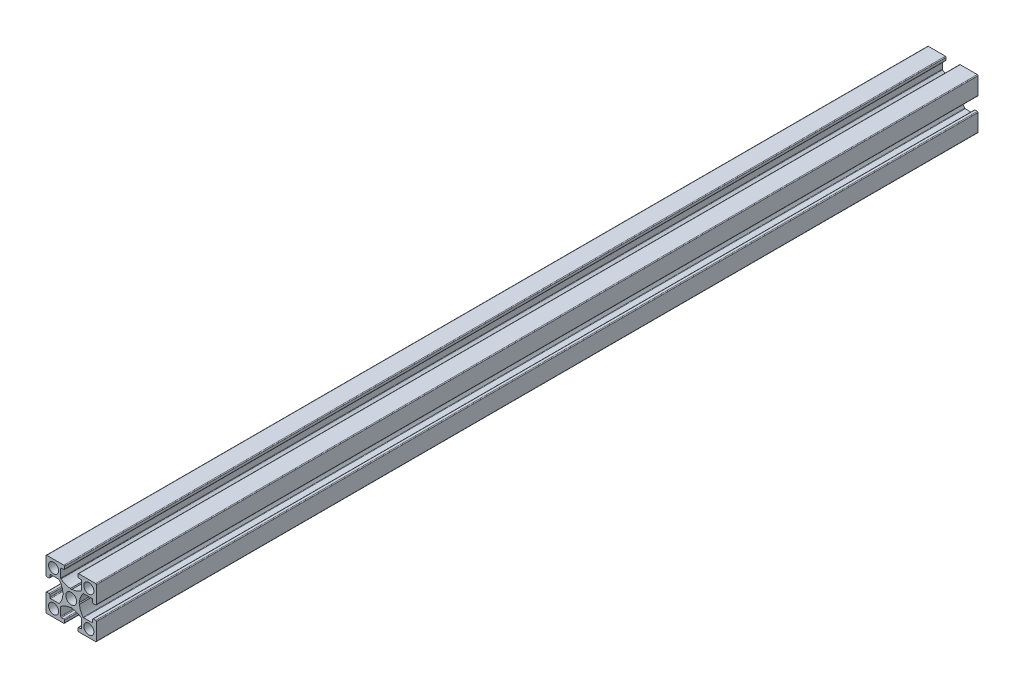
from build123d import *

# Parameters (mm, degrees)
MODEL_R                 = 2.15
MODEL_R_2               = 2
EXTRUDE_1_DEPTH         = 350
CUT_EXTRUDE_START       = -18.707817398
CUT_EXTRUDE_1_OUTLINE_R = 2.5
CUT_EXTRUDE_1_DEPTH     = 9.415634796
SKETCH_2_R              = 2.5
CUT_EXTRUDE_2_DEPTH     = 2341.023376847
SKETCH_4_R              = 2.5
CUT_EXTRUDE_4_DEPTH     = 2341.023376847


with BuildPart() as part:
    # Model → 보스-돌출1 (new body)
    with BuildSketch(Plane.XY):
        with BuildLine():
            Line((2307.763927197, 1192.134297913), (2307.763927197, 1195.391548465))
            ThreePointArc((2307.763927197, 1195.391548465), (2307.676059232, 1195.603680499), (2307.463927197, 1195.691548465))
            Line((2307.463927197, 1195.691548465), (2306.563927197, 1195.691548465))
            ThreePointArc((2306.563927197, 1195.691548465), (2306.351795163, 1195.779416431), (2306.263927197, 1195.991548465))
            Line((2306.263927197, 1195.991548465), (2306.263927197, 1196.891548465))
            ThreePointArc((2306.263927197, 1196.891548465), (2306.351795163, 1197.103680499), (2306.563927197, 1197.191548465))
            Line((2306.563927197, 1197.191548465), (2313.313927197, 1197.191548465))
            ThreePointArc((2313.313927197, 1197.191548465), (2313.526059232, 1197.103680499), (2313.613927197, 1196.891548465))
            Line((2313.613927197, 1196.891548465), (2313.613927197, 1190.141548465))
            ThreePointArc((2313.613927197, 1190.141548465), (2313.526059232, 1189.929416431), (2313.313927197, 1189.841548465))
            Line((2313.313927197, 1189.841548465), (2312.413927197, 1189.841548465))
            ThreePointArc((2312.413927197, 1189.841548465), (2312.201795163, 1189.929416431), (2312.113927197, 1190.141548465))
            Line((2312.113927197, 1190.141548465), (2312.113927197, 1191.041548465))
            ThreePointArc((2312.113927197, 1191.041548465), (2312.026059232, 1191.253680499), (2311.813927197, 1191.341548465))
            Line((2311.813927197, 1191.341548465), (2308.556676645, 1191.341548465))
            ThreePointArc((2308.556676645, 1191.341548465), (2308.426234796, 1191.311705686), (2308.321744595, 1191.228114625))
            ThreePointArc((2308.321744595, 1191.228114625), (2307.328306374, 1189.47356999), (2306.921204563, 1187.498825831))
            Line((2306.921204563, 1187.498825831), (2306.613927197, 1187.191548465))
            Line((2306.613927197, 1187.191548465), (2306.921204563, 1186.884271099))
            ThreePointArc((2306.921204563, 1186.884271099), (2307.328306374, 1184.90952694), (2308.321744595, 1183.154982305))
            ThreePointArc((2308.321744595, 1183.154982305), (2308.426234796, 1183.071391244), (2308.556676645, 1183.041548465))
            Line((2308.556676645, 1183.041548465), (2311.813927197, 1183.041548465))
            ThreePointArc((2311.813927197, 1183.041548465), (2312.026059232, 1183.129416431), (2312.113927197, 1183.341548465))
            Line((2312.113927197, 1183.341548465), (2312.113927197, 1184.241548465))
            ThreePointArc((2312.113927197, 1184.241548465), (2312.201795163, 1184.453680499), (2312.413927197, 1184.541548465))
            Line((2312.413927197, 1184.541548465), (2313.313927197, 1184.541548465))
            ThreePointArc((2313.313927197, 1184.541548465), (2313.526059232, 1184.453680499), (2313.613927197, 1184.241548465))
            Line((2313.613927197, 1184.241548465), (2313.613927197, 1177.491548465))
            ThreePointArc((2313.613927197, 1177.491548465), (2313.526059232, 1177.279416431), (2313.313927197, 1177.191548465))
            Line((2313.313927197, 1177.191548465), (2306.563927197, 1177.191548465))
            ThreePointArc((2306.563927197, 1177.191548465), (2306.351795163, 1177.279416431), (2306.263927197, 1177.491548465))
            Line((2306.263927197, 1177.491548465), (2306.263927197, 1178.391548465))
            ThreePointArc((2306.263927197, 1178.391548465), (2306.351795163, 1178.603680499), (2306.563927197, 1178.691548465))
            Line((2306.563927197, 1178.691548465), (2307.463927197, 1178.691548465))
            ThreePointArc((2307.463927197, 1178.691548465), (2307.676059232, 1178.779416431), (2307.763927197, 1178.991548465))
            Line((2307.763927197, 1178.991548465), (2307.763927197, 1182.248799017))
            ThreePointArc((2307.763927197, 1182.248799017), (2307.734084418, 1182.379240866), (2307.650493357, 1182.483731067))
            ThreePointArc((2307.650493357, 1182.483731067), (2305.895948722, 1183.477169289), (2303.921204563, 1183.884271099))
            Line((2303.921204563, 1183.884271099), (2303.613927197, 1184.191548465))
            Line((2303.613927197, 1184.191548465), (2303.306649831, 1183.884271099))
            ThreePointArc((2303.306649831, 1183.884271099), (2301.331905673, 1183.477169289), (2299.577361038, 1182.483731067))
            ThreePointArc((2299.577361038, 1182.483731067), (2299.493769977, 1182.379240866), (2299.463927197, 1182.248799017))
            Line((2299.463927197, 1182.248799017), (2299.463927197, 1178.991548465))
            ThreePointArc((2299.463927197, 1178.991548465), (2299.551795163, 1178.779416431), (2299.763927197, 1178.691548465))
            Line((2299.763927197, 1178.691548465), (2300.663927197, 1178.691548465))
            ThreePointArc((2300.663927197, 1178.691548465), (2300.876059232, 1178.603680499), (2300.963927197, 1178.391548465))
            Line((2300.963927197, 1178.391548465), (2300.963927197, 1177.491548465))
            ThreePointArc((2300.963927197, 1177.491548465), (2300.876059232, 1177.279416431), (2300.663927197, 1177.191548465))
            Line((2300.663927197, 1177.191548465), (2293.913927197, 1177.191548465))
            ThreePointArc((2293.913927197, 1177.191548465), (2293.701795163, 1177.279416431), (2293.613927197, 1177.491548465))
            Line((2293.613927197, 1177.491548465), (2293.613927197, 1184.241548465))
            ThreePointArc((2293.613927197, 1184.241548465), (2293.701795163, 1184.453680499), (2293.913927197, 1184.541548465))
            Line((2293.913927197, 1184.541548465), (2294.813927197, 1184.541548465))
            ThreePointArc((2294.813927197, 1184.541548465), (2295.026059232, 1184.453680499), (2295.113927197, 1184.241548465))
            Line((2295.113927197, 1184.241548465), (2295.113927197, 1183.341548465))
            ThreePointArc((2295.113927197, 1183.341548465), (2295.201795163, 1183.129416431), (2295.413927197, 1183.041548465))
            Line((2295.413927197, 1183.041548465), (2298.671177749, 1183.041548465))
            ThreePointArc((2298.671177749, 1183.041548465), (2298.801619599, 1183.071391244), (2298.906109799, 1183.154982305))
            ThreePointArc((2298.906109799, 1183.154982305), (2299.899548021, 1184.90952694), (2300.306649831, 1186.884271099))
            Line((2300.306649831, 1186.884271099), (2300.613927197, 1187.191548465))
            Line((2300.613927197, 1187.191548465), (2300.306649831, 1187.498825831))
            ThreePointArc((2300.306649831, 1187.498825831), (2299.899548021, 1189.47356999), (2298.906109799, 1191.228114625))
            ThreePointArc((2298.906109799, 1191.228114625), (2298.801619599, 1191.311705686), (2298.671177749, 1191.341548465))
            Line((2298.671177749, 1191.341548465), (2295.413927197, 1191.341548465))
            ThreePointArc((2295.413927197, 1191.341548465), (2295.201795163, 1191.253680499), (2295.113927197, 1191.041548465))
            Line((2295.113927197, 1191.041548465), (2295.113927197, 1190.141548465))
            ThreePointArc((2295.113927197, 1190.141548465), (2295.026059232, 1189.929416431), (2294.813927197, 1189.841548465))
            Line((2294.813927197, 1189.841548465), (2293.913927197, 1189.841548465))
            ThreePointArc((2293.913927197, 1189.841548465), (2293.701795163, 1189.929416431), (2293.613927197, 1190.141548465))
            Line((2293.613927197, 1190.141548465), (2293.613927197, 1196.891548465))
            ThreePointArc((2293.613927197, 1196.891548465), (2293.701795163, 1197.103680499), (2293.913927197, 1197.191548465))
            Line((2293.913927197, 1197.191548465), (2300.663927197, 1197.191548465))
            ThreePointArc((2300.663927197, 1197.191548465), (2300.876059232, 1197.103680499), (2300.963927197, 1196.891548465))
            Line((2300.963927197, 1196.891548465), (2300.963927197, 1195.991548465))
            ThreePointArc((2300.963927197, 1195.991548465), (2300.876059232, 1195.779416431), (2300.663927197, 1195.691548465))
            Line((2300.663927197, 1195.691548465), (2299.763927197, 1195.691548465))
            ThreePointArc((2299.763927197, 1195.691548465), (2299.551795163, 1195.603680499), (2299.463927197, 1195.391548465))
            Line((2299.463927197, 1195.391548465), (2299.463927197, 1192.134297913))
            ThreePointArc((2299.463927197, 1192.134297913), (2299.493769977, 1192.003856063), (2299.577361038, 1191.899365863))
            ThreePointArc((2299.577361038, 1191.899365863), (2301.331905673, 1190.905927641), (2303.306649831, 1190.498825831))
            Line((2303.306649831, 1190.498825831), (2303.613927197, 1190.191548465))
            Line((2303.613927197, 1190.191548465), (2303.921204563, 1190.498825831))
            ThreePointArc((2303.921204563, 1190.498825831), (2305.895948722, 1190.905927641), (2307.650493357, 1191.899365863))
            ThreePointArc((2307.650493357, 1191.899365863), (2307.734084418, 1192.003856063), (2307.763927197, 1192.134297913))
        make_face()
        with Locations((2303.613927197, 1187.191548465)):
            Circle(MODEL_R, mode=Mode.SUBTRACT)
        with Locations((2296.613927197, 1194.191548465)):
            Circle(MODEL_R_2, mode=Mode.SUBTRACT)
        with Locations((2296.613927197, 1180.191548465)):
            Circle(MODEL_R_2, mode=Mode.SUBTRACT)
        with Locations((2310.613927197, 1194.191548465)):
            Circle(MODEL_R_2, mode=Mode.SUBTRACT)
        with Locations((2310.613927197, 1180.191548465)):
            Circle(MODEL_R_2, mode=Mode.SUBTRACT)
    extrude(amount=EXTRUDE_1_DEPTH)

    # 컷-돌출1: read off the stored shape, not the designer's step
    # 컷-돌출1 outline → 컷-돌출1 (cut)
    with BuildSketch(Plane(origin=(1269.285927197, 1173.191548465, 19.026182812), x_dir=(1, 0, 0), z_dir=(0, -1, 0)).offset(CUT_EXTRUDE_START)):
        with Locations((1034.328, 255.973817188)):
            Circle(CUT_EXTRUDE_1_OUTLINE_R)
        with Locations((1034.328, 222.973817188)):
            Circle(CUT_EXTRUDE_1_OUTLINE_R)
        with Locations((1034.328, 88.973817188)):
            Circle(CUT_EXTRUDE_1_OUTLINE_R)
        with Locations((1034.328, 55.973817188)):
            Circle(CUT_EXTRUDE_1_OUTLINE_R)
        with Locations((1034.328, 20.973817188)):
            Circle(CUT_EXTRUDE_1_OUTLINE_R)
        with Locations((1034.328, 290.973817188)):
            Circle(CUT_EXTRUDE_1_OUTLINE_R)
    extrude(amount=CUT_EXTRUDE_1_DEPTH, mode=Mode.SUBTRACT)

    # 스케치2 → 컷-돌출2 (cut, through all)
    with BuildSketch(Plane(origin=(0, 1197.191548465, 0), x_dir=(1, 0, 0), z_dir=(0, 1, 0))):
        with Locations(Location((2303.613927197, -10, 0), (0, 0, 270))):
            Circle(SKETCH_2_R)
        with Locations(Location((2303.613927197, -340, 0), (0, 0, 270))):
            Circle(SKETCH_2_R)
    extrude(amount=-CUT_EXTRUDE_2_DEPTH, mode=Mode.SUBTRACT)

    # 스케치4 → 컷-돌출4 (cut, through all)
    with BuildSketch(Plane.XZ.offset(-1177.191548465)):
        with Locations(Location((2303.613927197, 263.628129282, 0), (0, 0, 270))):
            Circle(SKETCH_4_R)
        with Locations(Location((2303.613927197, 210.06643017, 0), (0, 0, 270))):
            Circle(SKETCH_4_R)
        with Locations(Location((2303.613927197, 140.06643022, 0), (0, 0, 270))):
            Circle(SKETCH_4_R)
        with Locations(Location((2303.613927197, 86.5, 0), (0, 0, 270))):
            Circle(SKETCH_4_R)
    extrude(amount=-CUT_EXTRUDE_4_DEPTH, mode=Mode.SUBTRACT)


solid = part.part
